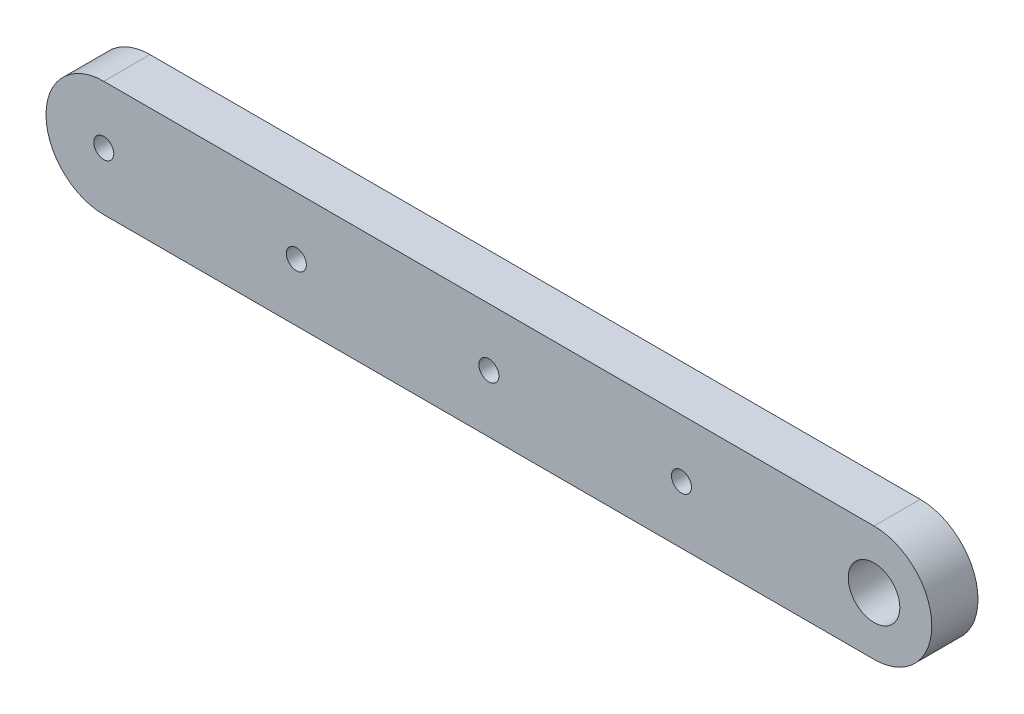
from build123d import *

# Parameters (mm, degrees)
BOSS_EXTRUDE1_DEPTH = 6
SKETCH2_R           = 1.3
CUT_EXTRUDE1_DEPTH  = 108.928216885
LPATTERN1_COUNT     = 4
LPATTERN1_PITCH     = 25
SKETCH3_R           = 3.35
CUT_EXTRUDE2_DEPTH  = 108.928216885


with BuildPart() as part:
    # Sketch1 → Boss-Extrude1 (new body)
    with BuildSketch(Plane.XY):
        with BuildLine():
            Line((100, 7.5), (0, 7.5))
            ThreePointArc((0, 7.5), (-7.5, 0), (0, -7.5))
            Line((0, -7.5), (100, -7.5))
            ThreePointArc((100, -7.5), (107.5, 0), (100, 7.5))
        make_face()
    extrude(amount=BOSS_EXTRUDE1_DEPTH)

    # Sketch2 → Cut-Extrude1 (cut, through all)
    with BuildSketch(Plane.XY.offset(6)):
        Circle(SKETCH2_R)
        with Locations((100, 0)):
            Circle(SKETCH2_R)
    cut_extrude1 = extrude(amount=-CUT_EXTRUDE1_DEPTH, mode=Mode.SUBTRACT)

    # LPattern1: Cut-Extrude1 ×4
    with Locations(*[(i * LPATTERN1_PITCH, 0, 0) for i in range(1, LPATTERN1_COUNT)]):
        add(cut_extrude1, mode=Mode.SUBTRACT)

    # Sketch3 → Cut-Extrude2 (cut, through all)
    with BuildSketch(Plane.XY.offset(6)):
        with Locations((100, 0)):
            Circle(SKETCH3_R)
    extrude(amount=-CUT_EXTRUDE2_DEPTH, mode=Mode.SUBTRACT)


solid = part.part
